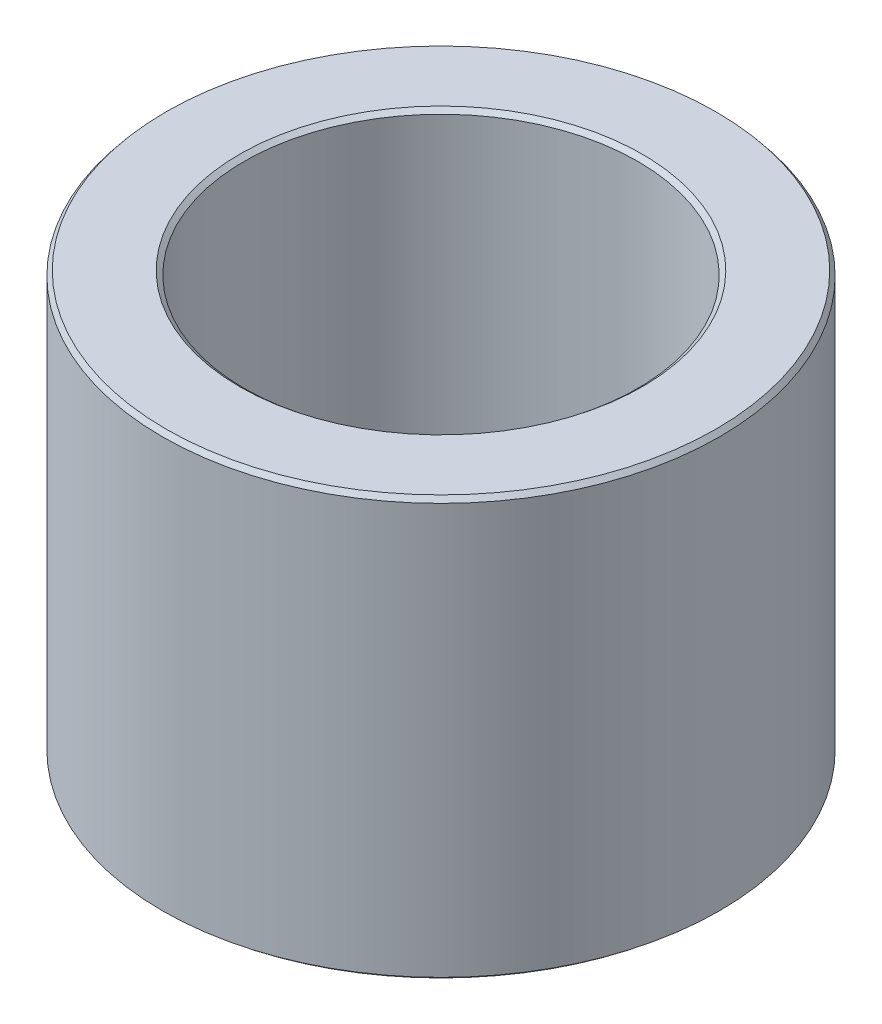
from build123d import *
from OCP.BRepFilletAPI import BRepFilletAPI_MakeChamfer

# Parameters (mm, degrees)
SKETCH1_R           = 55
BOSS_EXTRUDE1_DEPTH = 82.68062411
SKETCH2_R           = 38.821711619
CUT_EXTRUDE1_DEPTH  = 114.516895673
CHAMFER1_SIZE       = 0.921136416
CHAMFER1_SIZE2      = 0.753056338


with BuildPart() as part:
    # Sketch1 → Boss-Extrude1 (new body)
    with BuildSketch(Plane(origin=(0, 0, 0), x_dir=(1, 0, 0), z_dir=(0, 1, 0))):
        Circle(SKETCH1_R)
    extrude(amount=BOSS_EXTRUDE1_DEPTH)

    # Sketch2 → Cut-Extrude1 (cut, through all)
    with BuildSketch(Plane(origin=(0, 0, 0), x_dir=(1, 0, 0), z_dir=(0, 1, 0))):
        Circle(SKETCH2_R)
    extrude(amount=CUT_EXTRUDE1_DEPTH, mode=Mode.SUBTRACT)

    # Chamfer1: one chamfer whose edges measure the first distance from different faces: ONE call of the kernel's chamfer builder (chamfer() names one face for all edges)
    chamfer1_edges_1 = [part.edges().sort_by_distance(p)[0] for p in [
        (-38.821711619, 82.68062411, 0),
    ]]
    chamfer1_side_1 = [part.faces().sort_by_distance(p)[0] for p in [
        (-53.444365081, 82.68062411, 0),
    ]]
    chamfer1_edges_2 = [part.edges().sort_by_distance(p)[0] for p in [
        (-38.821711619, 0, 0),
    ]]
    chamfer1_side_2 = [part.faces().sort_by_distance(p)[0] for p in [
        (-38.821711619, 41.340312055, 0),
    ]]
    chamfer1_edges_3 = [part.edges().sort_by_distance(p)[0] for p in [
        (-55, 0, 0),
    ]]
    chamfer1_side_3 = [part.faces().sort_by_distance(p)[0] for p in [
        (-53.444365081, 0, 0),
    ]]
    chamfer1_edges_4 = [part.edges().sort_by_distance(p)[0] for p in [
        (-55, 82.68062411, 0),
    ]]
    chamfer1_side_4 = [part.faces().sort_by_distance(p)[0] for p in [
        (-55, 41.340312055, 0),
    ]]
    chamfer1 = BRepFilletAPI_MakeChamfer(part.part.solid().wrapped)
    for e in chamfer1_edges_1:
        chamfer1.Add(CHAMFER1_SIZE, CHAMFER1_SIZE2, e.wrapped, chamfer1_side_1[0].wrapped)  # the first distance lies on this face
    for e in chamfer1_edges_2:
        chamfer1.Add(CHAMFER1_SIZE, CHAMFER1_SIZE2, e.wrapped, chamfer1_side_2[0].wrapped)  # the first distance lies on this face
    for e in chamfer1_edges_3:
        chamfer1.Add(CHAMFER1_SIZE, CHAMFER1_SIZE2, e.wrapped, chamfer1_side_3[0].wrapped)  # the first distance lies on this face
    for e in chamfer1_edges_4:
        chamfer1.Add(CHAMFER1_SIZE, CHAMFER1_SIZE2, e.wrapped, chamfer1_side_4[0].wrapped)  # the first distance lies on this face
    add(Compound.cast(chamfer1.Shape()), mode=Mode.REPLACE)


solid = part.part
